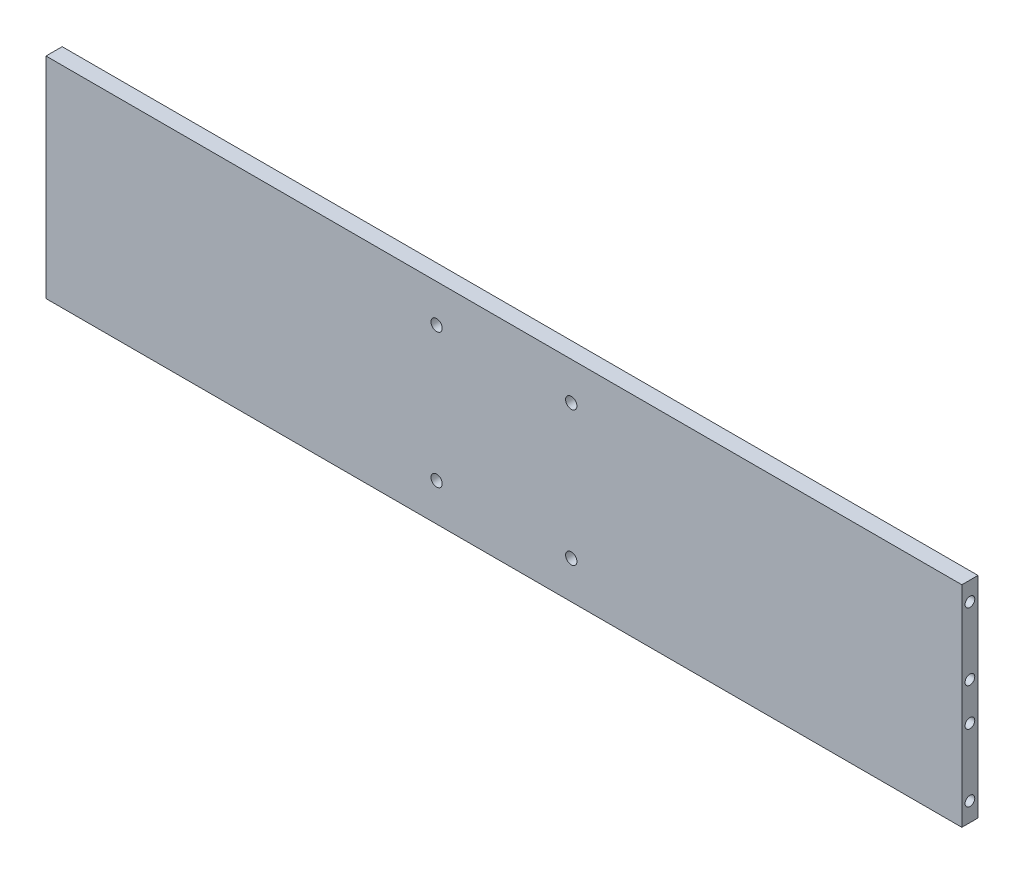
from build123d import *

# Parameters (mm, degrees)
SKETCH1_W           = 340
SKETCH1_H           = 78
SKETCH1_R           = 2.1
BOSS_EXTRUDE1_DEPTH = 6
CUT_EXTRUDE1_REACH  = 344.282
SKETCH2_R           = 1.8


with BuildPart() as part:
    # Sketch1 → Boss-Extrude1 (new body)
    with BuildSketch(Plane.XY):
        Rectangle(SKETCH1_W, SKETCH1_H)
        with Locations((-25, 25)):
            Circle(SKETCH1_R, mode=Mode.SUBTRACT)
        with Locations((25, 25)):
            Circle(SKETCH1_R, mode=Mode.SUBTRACT)
        with Locations((25, -25)):
            Circle(SKETCH1_R, mode=Mode.SUBTRACT)
        with Locations((-25, -25)):
            Circle(SKETCH1_R, mode=Mode.SUBTRACT)
    extrude(amount=BOSS_EXTRUDE1_DEPTH)

    # Sketch2 → Cut-Extrude1 (cut, up to next)
    with BuildSketch(Plane(origin=(170, 0, 0), x_dir=(0, 0, -1), z_dir=(1, 0, 0)), mode=Mode.PRIVATE) as cut_extrude1_sk1:
        with Locations((-3, 32)):
            Circle(SKETCH2_R)
    cut_extrude1_tool1 = extrude(cut_extrude1_sk1.sketch, amount=-CUT_EXTRUDE1_REACH, mode=Mode.PRIVATE) & part.part
    # Sketch2 → Cut-Extrude1 (cut, up to next)
    with BuildSketch(Plane(origin=(170, 0, 0), x_dir=(0, 0, -1), z_dir=(1, 0, 0)), mode=Mode.PRIVATE) as cut_extrude1_sk2:
        with Locations((-3, 7)):
            Circle(SKETCH2_R)
    cut_extrude1_tool2 = extrude(cut_extrude1_sk2.sketch, amount=-CUT_EXTRUDE1_REACH, mode=Mode.PRIVATE) & part.part
    # Sketch2 → Cut-Extrude1 (cut, up to next)
    with BuildSketch(Plane(origin=(170, 0, 0), x_dir=(0, 0, -1), z_dir=(1, 0, 0)), mode=Mode.PRIVATE) as cut_extrude1_sk3:
        with Locations((-3, -7)):
            Circle(SKETCH2_R)
    cut_extrude1_tool3 = extrude(cut_extrude1_sk3.sketch, amount=-CUT_EXTRUDE1_REACH, mode=Mode.PRIVATE) & part.part
    # Sketch2 → Cut-Extrude1 (cut, up to next)
    with BuildSketch(Plane(origin=(170, 0, 0), x_dir=(0, 0, -1), z_dir=(1, 0, 0)), mode=Mode.PRIVATE) as cut_extrude1_sk4:
        with Locations((-3, -32)):
            Circle(SKETCH2_R)
    cut_extrude1_tool4 = extrude(cut_extrude1_sk4.sketch, amount=-CUT_EXTRUDE1_REACH, mode=Mode.PRIVATE) & part.part
    add(cut_extrude1_tool1.solids().sort_by_distance((170, 32, 3))[0], mode=Mode.SUBTRACT)
    add(cut_extrude1_tool2.solids().sort_by_distance((170, 7, 3))[0], mode=Mode.SUBTRACT)
    add(cut_extrude1_tool3.solids().sort_by_distance((170, -7, 3))[0], mode=Mode.SUBTRACT)
    add(cut_extrude1_tool4.solids().sort_by_distance((170, -32, 3))[0], mode=Mode.SUBTRACT)


solid = part.part
